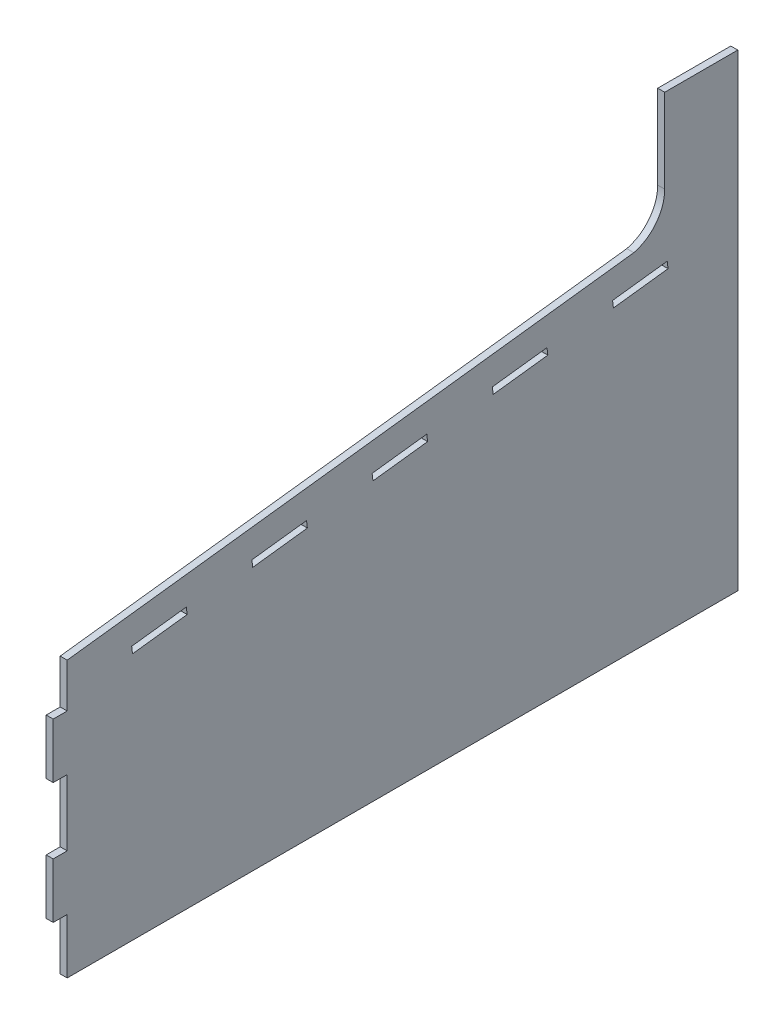
from build123d import *

# Parameters (mm, degrees)
BOSS_EXTRUDE1_DEPTH = 6.35
CUT_EXTRUDE1_DEPTH  = 6.35


with BuildPart() as part:
    # Sketch1 → Boss-Extrude1 (new body)
    with BuildSketch(Plane(origin=(0, 0, 0), x_dir=(0, 0, -1), z_dir=(1, 0, 0))):
        with BuildLine():
            Line((0, 250), (514.569488044, 313.181188643))
            ThreePointArc((514.569488044, 313.181188643), (534.796363904, 326.297688332), (542.65, 349.09))
            Line((542.65, 349.09), (542.65, 425.32))
            Line((542.65, 425.32), (609, 425.32))
            Line((609, 425.32), (609, 250))
            Line((609, 250), (609, 0))
            Line((609, 0), (0, 0))
            Line((0, 0), (0, 50))
            Line((0, 50), (-12.7, 50))
            Line((-12.7, 50), (-12.7, 100))
            Line((-12.7, 100), (0, 100))
            Line((0, 100), (0, 160))
            Line((0, 160), (-12.7, 160))
            Line((-12.7, 160), (-12.7, 210))
            Line((-12.7, 210), (0, 210))
            Line((0, 210), (0, 250))
        make_face()
    extrude(amount=BOSS_EXTRUDE1_DEPTH)

    # Sketch2 → Cut-Extrude1 (cut)
    with BuildSketch(Plane(origin=(6.35, 0, 0), x_dir=(0, 0, -1), z_dir=(1, 0, 0))):
        Polygon((58.560222947, 231.599541694), (59.334093277, 225.296873631), (108.96140086, 231.390340802), (108.187530529, 237.693008865), align=None)
        Polygon((217.367607209, 251.098636639), (167.740299627, 245.005169469), (168.514169958, 238.702501406), (218.14147754, 244.795968576), align=None)
        Polygon((326.54768389, 264.504264414), (276.920376308, 258.410797243), (277.694246639, 252.10812918), (327.321554221, 258.201596351), align=None)
        Polygon((435.727760571, 277.909892188), (386.100452988, 271.816425018), (386.874323319, 265.513756955), (436.501630901, 271.607224125), align=None)
        Polygon((544.907837251, 291.315519963), (495.280529669, 285.222052793), (496.0544, 278.91938473), (545.681707582, 285.0128519), align=None)
    extrude(amount=-CUT_EXTRUDE1_DEPTH, mode=Mode.SUBTRACT)


solid = part.part
